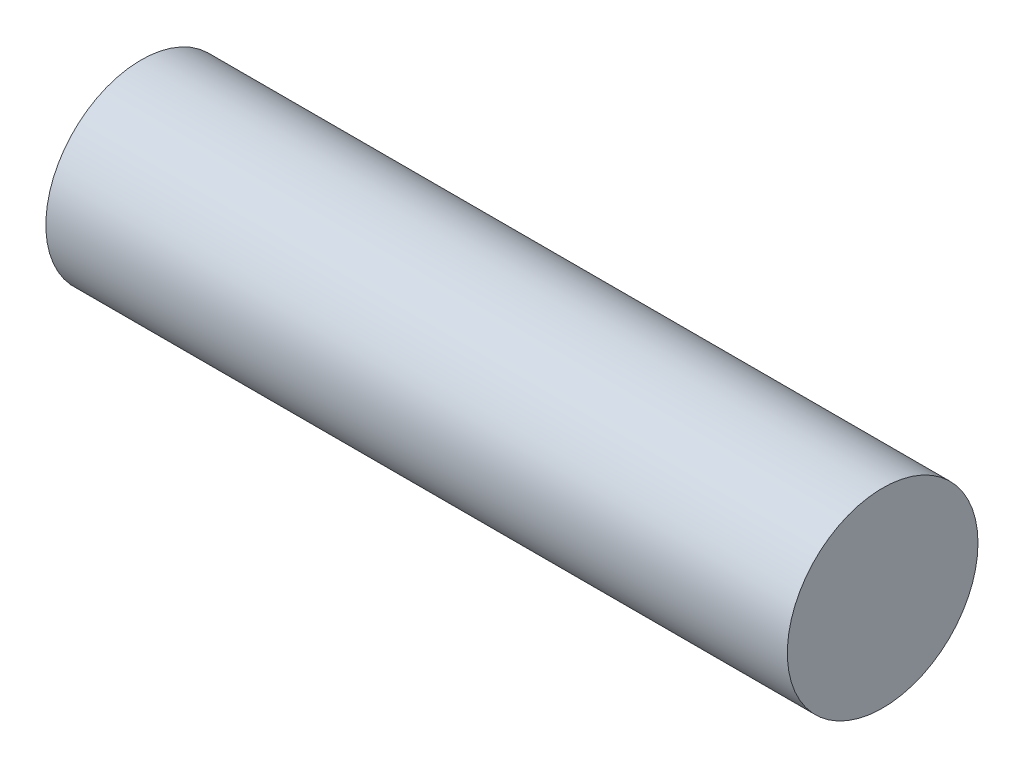
from build123d import *

# Parameters (mm, degrees)
SKETCH1_R           = 9
BOSS_EXTRUDE1_DEPTH = 70


with BuildPart() as part:
    # Sketch1 → Boss-Extrude1 (new body)
    with BuildSketch(Plane.YZ):
        Circle(SKETCH1_R)
    extrude(amount=BOSS_EXTRUDE1_DEPTH)


solid = part.part
